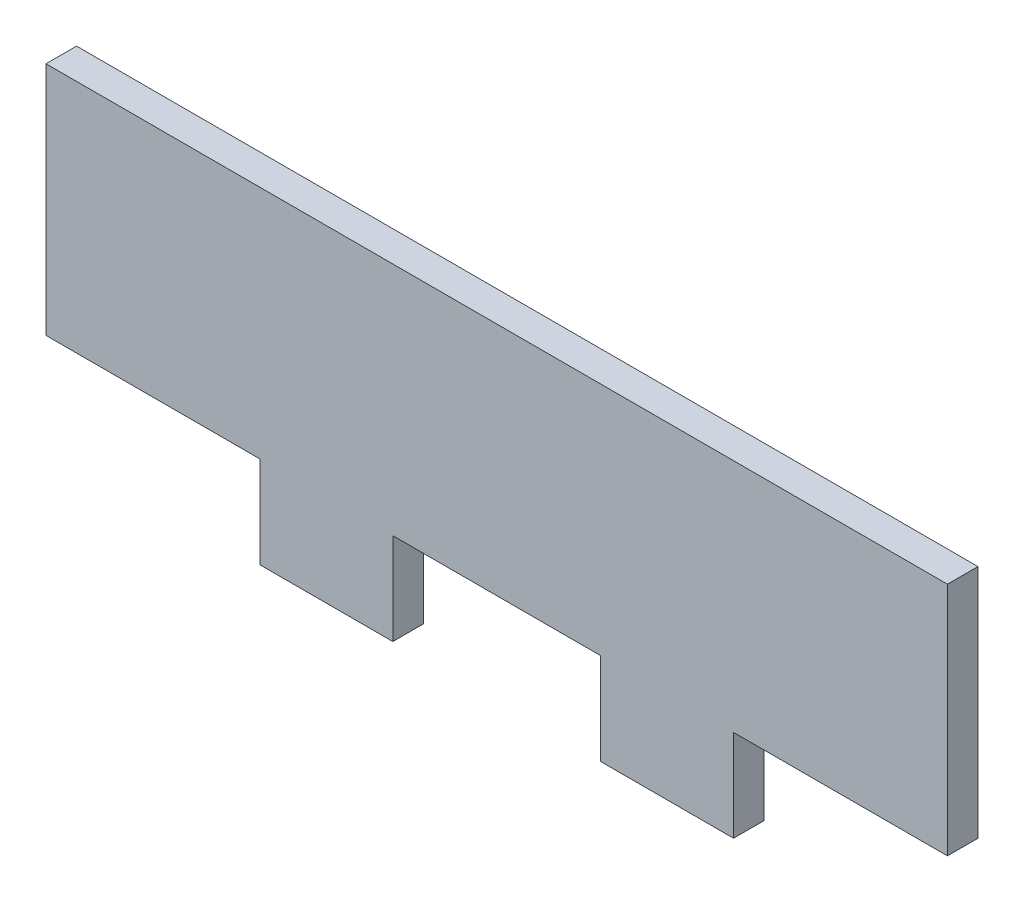
from build123d import *

# Parameters (mm, degrees)
SKETCH1_W           = 147.5
SKETCH1_H           = 53.5
BOSS_EXTRUDE1_DEPTH = 5
SKETCH2_R           = 5
BOSS_EXTRUDE2_DEPTH = 7
SKETCH3_W           = 35
SKETCH3_H           = 15
CUT_EXTRUDE1_DEPTH  = 80.363877173
SKETCH4_W           = 34
SKETCH4_H           = 15
CUT_EXTRUDE2_DEPTH  = 10


with BuildPart() as part:
    # Sketch1 → Boss-Extrude1 (new body)
    with BuildSketch(Plane.XY):
        Rectangle(SKETCH1_W, SKETCH1_H)
    extrude(amount=BOSS_EXTRUDE1_DEPTH)

    # Sketch2 → Boss-Extrude2 (add)
    with BuildSketch(Plane(origin=(0, 0, 0), x_dir=(-1, 0, 0), z_dir=(0, 0, -1))):
        with Locations((12.5, 9.25)):
            Circle(SKETCH2_R)
        with Locations((-12.5, 9.25)):
            Circle(SKETCH2_R)
    extrude(amount=BOSS_EXTRUDE2_DEPTH)

    # Sketch3 → Cut-Extrude1 (cut, through all)
    with BuildSketch(Plane.XY.offset(5)):
        with Locations((-56.25, -19.25)):
            Rectangle(SKETCH3_W, SKETCH3_H)
        with Locations((56.25, -19.25)):
            Rectangle(SKETCH3_W, SKETCH3_H)
    extrude(amount=-CUT_EXTRUDE1_DEPTH, mode=Mode.SUBTRACT)

    # Sketch4 → Cut-Extrude2 (cut)
    with BuildSketch(Plane.XY.offset(5)):
        with Locations((0, -19.25)):
            Rectangle(SKETCH4_W, SKETCH4_H)
    extrude(amount=-CUT_EXTRUDE2_DEPTH, mode=Mode.SUBTRACT)


solid = part.part
